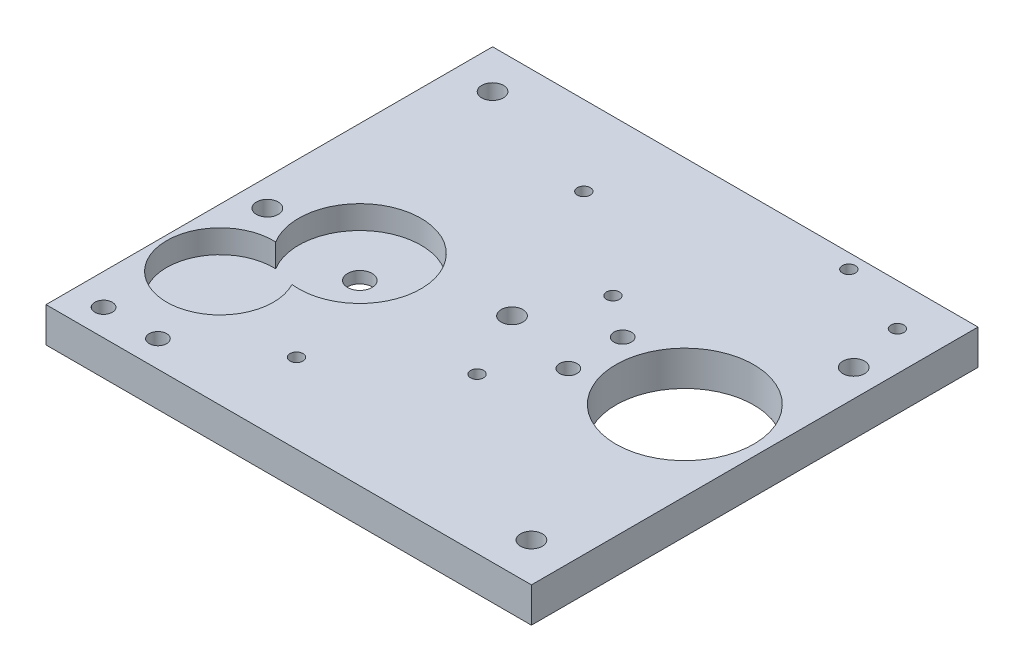
from build123d import *

# Parameters (mm, degrees)
SKETCH1_W               = 125
SKETCH1_H               = 115
TOP_BASE_DEPTH          = 9
GEARS_EXTRUDE_CUT_DEPTH = 6
SKETCH7_R               = 3.15
KEY_EXTRUDE_CUT_DEPTH   = 171.091152033
SKETCH8_R               = 17.75
THUMB_EXTRUDE_CUT_DEPTH = 171.091152033
SKETCH9_R               = 1.675
SKETCH9_R_2             = 2.25
MOUNT_HOLES_DEPTH       = 5
SKETCH11_R              = 2.8
CONNECT_HOLES_DEPTH     = 171.091152033


with BuildPart() as part:
    # Sketch1 → Top_Base (new body)
    with BuildSketch(Plane(origin=(0, 0, 0), x_dir=(1, 0, 0), z_dir=(0, 1, 0))):
        with Locations((62.5, 57.5)):
            Rectangle(SKETCH1_W, SKETCH1_H)
    extrude(amount=TOP_BASE_DEPTH)

    # Sketch5 → Gears_Extrude_Cut (cut)
    with BuildSketch(Plane(origin=(0, 9, 0), x_dir=(1, 0, 0), z_dir=(0, 1, 0))):
        with BuildLine():
            ThreePointArc((27.20769188, 36.147558197), (37.485146889, 65.072253006), (15.590335344, 43.557577116))
            ThreePointArc((15.590335344, 43.557577116), (7.605781292, 18.227670419), (27.20769188, 36.147558197))
        make_face()
    extrude(amount=-GEARS_EXTRUDE_CUT_DEPTH, mode=Mode.SUBTRACT)

    # Sketch7 → Key_Extrude_Cut (cut, through all)
    with BuildSketch(Plane(origin=(0, 9, 0), x_dir=(1, 0, 0), z_dir=(0, 1, 0))):
        with Locations((29.01540546, 51.79347369)):
            Circle(SKETCH7_R)
    extrude(amount=-KEY_EXTRUDE_CUT_DEPTH, mode=Mode.SUBTRACT)

    # Sketch8 → Thumb_Extrude_Cut (cut, through all)
    with BuildSketch(Plane(origin=(0, 9, 0), x_dir=(1, 0, 0), z_dir=(0, 1, 0))):
        with Locations((104.5, 60)):
            Circle(SKETCH8_R)
    extrude(amount=-THUMB_EXTRUDE_CUT_DEPTH, mode=Mode.SUBTRACT)

    # Sketch9 → Mount_Holes (cut)
    with BuildSketch(Plane(origin=(0, 9, 0), x_dir=(1, 0, 0), z_dir=(0, 1, 0))):
        with Locations((71, 75)):
            Circle(SKETCH9_R)
        with Locations((44, 94.5)):
            Circle(SKETCH9_R)
        with Locations((22, 6.820255536)):
            Circle(SKETCH9_R_2)
        with Locations((81.5, 67)):
            Circle(SKETCH9_R_2)
        with Locations((95.5, 111.25)):
            Circle(SKETCH9_R)
        with Locations((115, 104.25)):
            Circle(SKETCH9_R)
        with Locations((71, 40)):
            Circle(SKETCH9_R)
        with Locations((44, 20.5)):
            Circle(SKETCH9_R)
        with Locations((8, 6.820255536)):
            Circle(SKETCH9_R_2)
        with Locations((81.5, 53)):
            Circle(SKETCH9_R_2)
    extrude(amount=-MOUNT_HOLES_DEPTH, mode=Mode.SUBTRACT)

    # Sketch11 → Connect_Holes (cut, through all)
    with BuildSketch(Plane(origin=(0, 9, 0), x_dir=(1, 0, 0), z_dir=(0, 1, 0))):
        with Locations((10, 105)):
            Circle(SKETCH11_R)
        with Locations((115, 10)):
            Circle(SKETCH11_R)
        with Locations((62.5, 57.5)):
            Circle(SKETCH11_R)
        with Locations((118, 90)):
            Circle(SKETCH11_R)
        with Locations((7, 50)):
            Circle(SKETCH11_R)
    extrude(amount=-CONNECT_HOLES_DEPTH, mode=Mode.SUBTRACT)


solid = part.part
